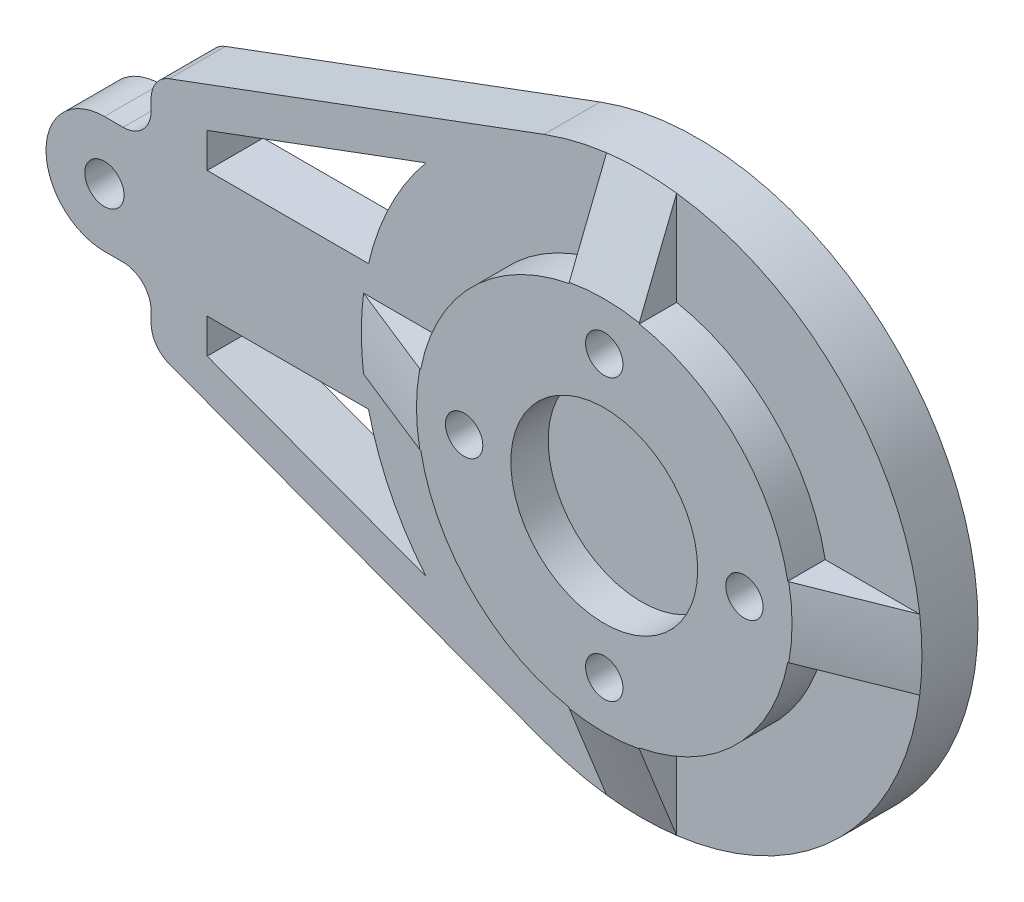
from build123d import *
from OCP.BRepFilletAPI import BRepFilletAPI_MakeChamfer
from build123d.topology import SkipClean

# Parameters (mm, degrees)
SKETCH2_R           = 40
SKETCH2_R_2         = 20
BOSS_EXTRUDE1_DEPTH = 8
BOSS_EXTRUDE2_DEPTH = 12
SKETCH4_R           = 7.5
CUT_EXTRUDE1_DEPTH  = 10
SKETCH5_R           = 4
CUT_EXTRUDE2_DEPTH  = 29
BOSS_EXTRUDE3_DEPTH = 8
CHAMFER3_SIZE       = 8
CHAMFER3_SIZE_2     = 19.800694827
BOSS_EXTRUDE4_DEPTH = 12
FILLET1_R           = 6
CUT_EXTRUDE3_DEPTH  = 6
SKETCH9_R           = 4.2
CUT_EXTRUDE4_DEPTH  = 6
CUT_EXTRUDE5_START  = -22
CUT_EXTRUDE5_DEPTH  = 22


with BuildPart() as part:
    # Sketch2 → Boss-Extrude1 (new body)
    with BuildSketch(Plane.XY):
        Circle(SKETCH2_R)
        Circle(SKETCH2_R_2, mode=Mode.SUBTRACT)
    extrude(amount=BOSS_EXTRUDE1_DEPTH)

    # Sketch3 → Boss-Extrude2 (add)
    with BuildSketch(Plane(origin=(0, 0, 0), x_dir=(-1, 0, 0), z_dir=(0, 0, -1))):
        with BuildLine():
            Line((105, -25), (105, 25))
            Line((105, 25), (20.894189842, 56.244402662))
            ThreePointArc((20.894189842, 56.244402662), (-60, 0), (20.894189842, -56.244402662))
            Line((20.894189842, -56.244402662), (105, -25))
        make_face()
    extrude(amount=BOSS_EXTRUDE2_DEPTH)

    # Sketch4 → Cut-Extrude1 (cut)
    with BuildSketch(Plane(origin=(0, 0, -12), x_dir=(-1, 0, 0), z_dir=(0, 0, -1))):
        with Locations((0, 30)):
            Circle(SKETCH4_R)
        with Locations((30, 0)):
            Circle(SKETCH4_R)
        with Locations((0, -30)):
            Circle(SKETCH4_R)
        with Locations((-30, 0)):
            Circle(SKETCH4_R)
    extrude(amount=-CUT_EXTRUDE1_DEPTH, mode=Mode.SUBTRACT)

    # Sketch5 → Cut-Extrude2 (cut)
    with BuildSketch(Plane(origin=(0, 0, -2), x_dir=(-1, 0, 0), z_dir=(0, 0, -1))):
        with Locations((30, 0)):
            Circle(SKETCH5_R)
        with Locations((0, -30)):
            Circle(SKETCH5_R)
        with Locations((-30, 0)):
            Circle(SKETCH5_R)
        with Locations((0, 30)):
            Circle(SKETCH5_R)
    extrude(amount=-CUT_EXTRUDE2_DEPTH, mode=Mode.SUBTRACT)

    # Sketch6 → Boss-Extrude3 (add)
    with SkipClean():  # the faces are left unmerged after this step: merging them gives an invalid solid
        with BuildSketch(Plane.XY):
            with BuildLine():
                Line((39.290584114, -7.5), (59.529404499, -7.5))
                ThreePointArc((59.529404499, -7.5), (60, 0), (59.529404499, 7.5))
                Line((59.529404499, 7.5), (39.290584114, 7.5))
                ThreePointArc((39.290584114, 7.5), (40, 0), (39.290584114, -7.5))
            make_face()
            with BuildLine():
                Line((-7.5, 39.290584114), (-7.5, 59.529404499))
                ThreePointArc((-7.5, 59.529404499), (0, 60), (7.5, 59.529404499))
                Line((7.5, 59.529404499), (7.5, 39.290584114))
                ThreePointArc((7.5, 39.290584114), (0, 40), (-7.5, 39.290584114))
            make_face()
            with BuildLine():
                Line((-7.5, -39.290584114), (-7.5, -59.529404499))
                ThreePointArc((-7.5, -59.529404499), (0, -60), (7.5, -59.529404499))
                Line((7.5, -59.529404499), (7.5, -39.290584114))
                ThreePointArc((7.5, -39.290584114), (0, -40), (-7.5, -39.290584114))
            make_face()
            with BuildLine():
                Line((-39.290584114, 7.5), (-59.529404499, 7.5))
                ThreePointArc((-59.529404499, 7.5), (-60, 0), (-59.529404499, -7.5))
                Line((-59.529404499, -7.5), (-39.290584114, -7.5))
                ThreePointArc((-39.290584114, -7.5), (-40, 0), (-39.290584114, 7.5))
            make_face()
        extrude(amount=BOSS_EXTRUDE3_DEPTH)

    # Chamfer3
    chamfer3_edges_1 = [part.edges().sort_by_distance(p)[0] for p in [
        (0, 60, 8),
    ]]
    chamfer3_side_1 = [part.faces().sort_by_distance(p)[0] for p in [
        (0, 60, 7.84),
    ]]
    chamfer3_edges_2 = [part.edges().sort_by_distance(p)[0] for p in [
        (60, 0, 8),
    ]]
    chamfer3_side_2 = [part.faces().sort_by_distance(p)[0] for p in [
        (60, 0, 7.84),
    ]]
    chamfer3_edges_3 = [part.edges().sort_by_distance(p)[0] for p in [
        (-60, 0, 8),
    ]]
    chamfer3_side_3 = [part.faces().sort_by_distance(p)[0] for p in [
        (-60, 0, 7.84),
    ]]
    chamfer3_edges_4 = [part.edges().sort_by_distance(p)[0] for p in [
        (0, -60, 8),
    ]]
    chamfer3_side_4 = [part.faces().sort_by_distance(p)[0] for p in [
        (0, -60, 7.84),
    ]]
    chamfer3 = BRepFilletAPI_MakeChamfer(part.part.solid().wrapped)
    for e in chamfer3_edges_1:
        chamfer3.Add(CHAMFER3_SIZE - 0.0001, CHAMFER3_SIZE_2 - 0.0001, e.wrapped, chamfer3_side_1[0].wrapped)
    for e in chamfer3_edges_2:
        chamfer3.Add(CHAMFER3_SIZE - 0.0001, CHAMFER3_SIZE_2 - 0.0001, e.wrapped, chamfer3_side_2[0].wrapped)
    for e in chamfer3_edges_3:
        chamfer3.Add(CHAMFER3_SIZE - 0.0001, CHAMFER3_SIZE_2 - 0.0001, e.wrapped, chamfer3_side_3[0].wrapped)
    for e in chamfer3_edges_4:
        chamfer3.Add(CHAMFER3_SIZE - 0.0001, CHAMFER3_SIZE_2 - 0.0001, e.wrapped, chamfer3_side_4[0].wrapped)
    add(Compound.cast(chamfer3.Shape()), mode=Mode.REPLACE)  # a hair under: the kernel refuses the full size

    # Sketch7 → Boss-Extrude4 (add)
    with BuildSketch(Plane(origin=(0, 0, -12), x_dir=(-1, 0, 0), z_dir=(0, 0, -1))):
        with BuildLine():
            Line((115, 12.5), (105, 12.5))
            Line((105, 12.5), (105, -12.5))
            Line((105, -12.5), (115, -12.5))
            ThreePointArc((115, -12.5), (127.5, 0), (115, 12.5))
        make_face()
    extrude(amount=-BOSS_EXTRUDE4_DEPTH)

    # Fillet1
    fillet1_edges = [part.edges().sort_by_distance(p)[0] for p in [
        (-105, -25, -6),
        (-105, 25, -6),
        (-105, -12.5, -6),
        (-105, 12.5, -6),
    ]]
    fillet(fillet1_edges, radius=FILLET1_R)

    # Sketch8 → Cut-Extrude3 (cut)
    with SkipClean():  # the faces are left unmerged after this step: merging them gives an invalid solid
        with BuildSketch(Plane(origin=(0, 0, -12), x_dir=(-1, 0, 0), z_dir=(0, 0, -1))):
            Polygon((118.778590974, 6.485027647), (111.2730968, 6.514869597), (107.494505826, 0.02984195), (111.221409026, -6.485027647), (118.7269032, -6.514869597), (122.505494174, -0.02984195), align=None)
        extrude(amount=-CUT_EXTRUDE3_DEPTH, mode=Mode.SUBTRACT)

    # Sketch9 → Cut-Extrude4 (cut)
    with SkipClean():  # the faces are left unmerged after this step: merging them gives an invalid solid
        with BuildSketch(Plane(origin=(0, 0, -6), x_dir=(-1, 0, 0), z_dir=(0, 0, -1))):
            with Locations((115, 0)):
                Circle(SKETCH9_R)
        extrude(amount=-CUT_EXTRUDE4_DEPTH, mode=Mode.SUBTRACT)

    # Sketch10 → Cut-Extrude5 (cut)
    with SkipClean():  # the faces are left unmerged after this step: merging them gives an invalid solid
        with BuildSketch(Plane.XY.offset(CUT_EXTRUDE5_START)):
            with BuildLine():
                Line((-58.46152581, -13.5), (-93, -13.5))
                Line((-93, -13.5), (-93, -20.923688206))
                Line((-93, -20.923688206), (-46.167935821, -38.321295672))
                ThreePointArc((-46.167935821, -38.321295672), (-53.766674065, -26.62977206), (-58.46152581, -13.5))
            make_face()
            with BuildLine():
                Line((-93, 20.923688206), (-46.167935821, 38.321295672))
                ThreePointArc((-46.167935821, 38.321295672), (-53.766674065, 26.62977206), (-58.46152581, 13.5))
                Line((-58.46152581, 13.5), (-93, 13.5))
                Line((-93, 13.5), (-93, 20.923688206))
            make_face()
        extrude(amount=CUT_EXTRUDE5_DEPTH, mode=Mode.SUBTRACT)


solid = part.part
